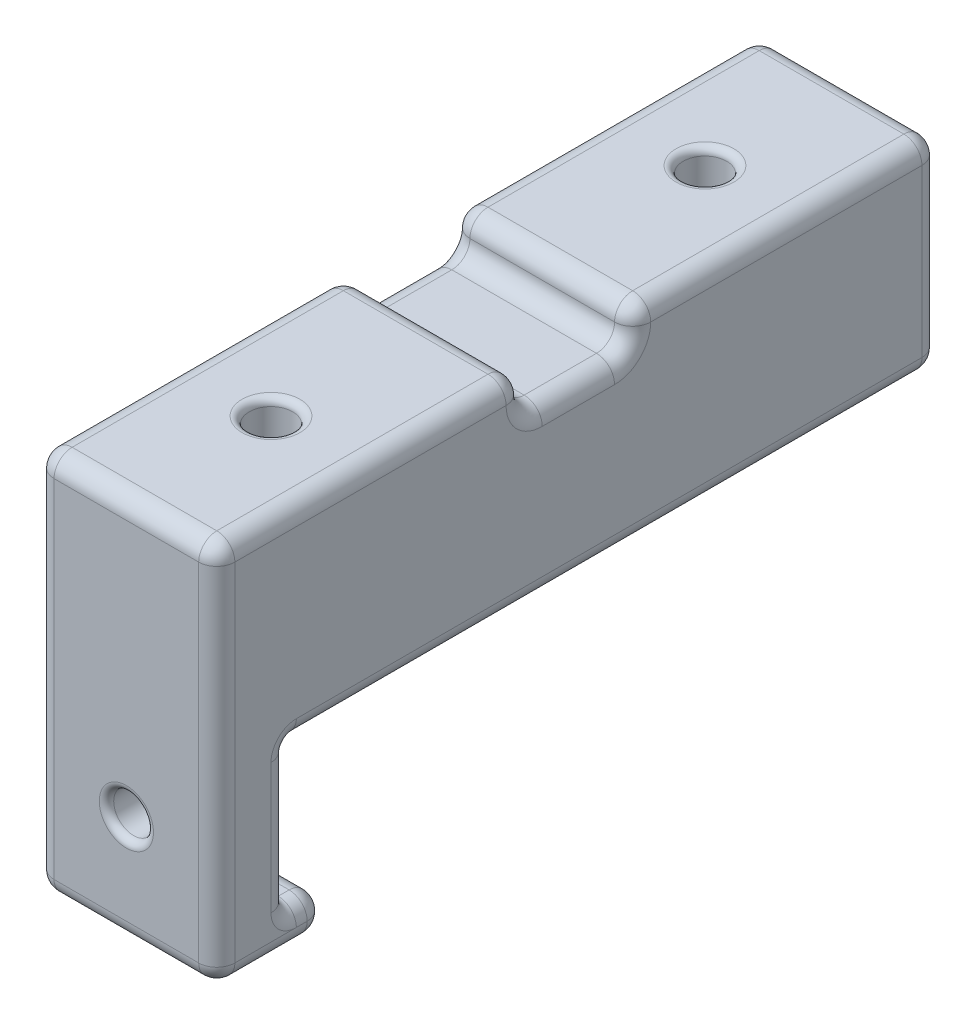
from build123d import *

# Parameters (mm, degrees)
SKETCH_1_W          = 25
SKETCH_1_H          = 100
EXTRUDE_1_DEPTH     = 28
SKETCH_2_R          = 3
CUT_EXTRUDE_1_DEPTH = 120.529983158
SKETCH_3_W          = 10
SKETCH_3_H          = 20
EXTRUDE_2_DEPTH     = 25
SKETCH_4_R          = 2.75
CUT_EXTRUDE_2_DEPTH = 120.529983158
SKETCH_5_W          = 25
SKETCH_5_H          = 5
EXTRUDE_3_DEPTH     = 15
SKETCH_6_R          = 6.5
CUT_EXTRUDE_3_DEPTH = 18
FILLET_1_R          = 1
FILLET_2_R          = 2.5
CUT_EXTRUDE_4_DEPTH = 5
FILLET_3_R          = 2.5


with BuildPart() as part:
    # 草图1 → 凸台-拉伸1 (new body)
    with BuildSketch(Plane(origin=(0, 0, 0), x_dir=(1, 0, 0), z_dir=(0, 1, 0))):
        with Locations((46.68966864, 50)):
            Rectangle(SKETCH_1_W, SKETCH_1_H)
    extrude(amount=EXTRUDE_1_DEPTH)

    # 草图2 → 切除-拉伸1 (cut, through all)
    with BuildSketch(Plane(origin=(0, 28, 0), x_dir=(1, 0, 0), z_dir=(0, 1, 0))):
        with Locations(Location((46.68966864, 80, 0), (0, 0, 270))):
            Circle(SKETCH_2_R)
        with Locations(Location((46.68966864, 20, 0), (0, 0, 270))):
            Circle(SKETCH_2_R)
    extrude(amount=-CUT_EXTRUDE_1_DEPTH, mode=Mode.SUBTRACT)

    # 草图3 → 凸台-拉伸2 (add)
    with BuildSketch(Plane(origin=(59.18966864, 0, 0), x_dir=(0, 0, -1), z_dir=(1, 0, 0))):
        with Locations((5, -10)):
            Rectangle(SKETCH_3_W, SKETCH_3_H)
    extrude(amount=-EXTRUDE_2_DEPTH)

    # 草图4 → 切除-拉伸2 (cut, through all)
    with BuildSketch(Plane.XY):
        with Locations((46.68966864, -10)):
            Circle(SKETCH_4_R)
    extrude(amount=-CUT_EXTRUDE_2_DEPTH, mode=Mode.SUBTRACT)

    # 草图5 → 凸台-拉伸3 (add)
    with BuildSketch(Plane.XY):
        with Locations((46.68966864, -22.5)):
            Rectangle(SKETCH_5_W, SKETCH_5_H)
    extrude(amount=-EXTRUDE_3_DEPTH)

    # 草图6 → 切除-拉伸3 (cut)
    with BuildSketch(Plane.XZ):
        with Locations(Location((46.68966864, -20, 0), (0, 0, 270))):
            Circle(SKETCH_6_R)
        with Locations(Location((46.68966864, -80, 0), (0, 0, 270))):
            Circle(SKETCH_6_R)
    extrude(amount=-CUT_EXTRUDE_3_DEPTH, mode=Mode.SUBTRACT)

    # 圆角1
    fillet_1_edges = [part.edges().sort_by_distance(p)[0] for p in [
        (46.68966864, 28, -83),
        (46.68966864, 28, -23),
        (46.68966864, -20, -10),
        (46.68966864, 0, -10),
        (43.93966864, -10, -10),
        (43.93966864, -10, 0),
        (46.68966864, 18, -13.5),
        (46.68966864, 18, -23),
        (46.68966864, 18, -73.5),
        (46.68966864, 18, -83),
    ]]
    fillet(fillet_1_edges, radius=FILLET_1_R)

    # 圆角2
    fillet_2_edges = [part.edges().sort_by_distance(p)[0] for p in [
        (59.18966864, 28, -50),
        (46.68966864, 28, -100),
        (34.18966864, -22.5, -15),
        (34.18966864, -25, -7.5),
        (34.18966864, -20, -13),
        (46.68966864, -20, -15),
        (34.18966864, 28, -50),
        (46.68966864, 0, -100),
        (59.18966864, -22.5, -15),
        (59.18966864, -20, -13),
        (46.68966864, -25, -15),
        (59.18966864, -25, -7.5),
        (46.68966864, -25, 0),
        (34.18966864, 0, -55.5),
        (46.68966864, 0, -13.5),
        (46.68966864, 0, -73.5),
        (34.18966864, -10, -10),
        (59.18966864, -10, -10),
        (34.18966864, 14, -100),
        (59.18966864, 14, -100),
        (59.18966864, 1.5, 0),
        (34.18966864, 1.5, 0),
        (46.68966864, 28, 0),
        (59.18966864, 0, -55.5),
        (59.18966864, -19.707106781, -10.292893219),
        (34.18966864, -19.707106781, -10.292893219),
        (59.18966864, -0.292893219, -10.292893219),
        (34.18966864, -0.292893219, -10.292893219),
    ]]
    fillet(fillet_2_edges, radius=FILLET_2_R - 0.0001)  # a hair under: the kernel refuses the full size

    # 草图7 → 切除-拉伸4 (cut)
    with BuildSketch(Plane(origin=(0, 28, 0), x_dir=(1, 0, 0), z_dir=(0, 1, 0))):
        Polygon((34.18966864, 50), (34.18966864, 57.5), (59.18966864, 57.5), (59.18966864, 42.5), (34.18966864, 42.5), align=None)
    extrude(amount=-CUT_EXTRUDE_4_DEPTH, mode=Mode.SUBTRACT)

    # 圆角3
    fillet_3_edges = [part.edges().sort_by_distance(p)[0] for p in [
        (46.68966864, 28, -57.5),
        (46.68966864, 28, -42.5),
        (58.457464883, 27.267796242, -57.5),
        (34.921872398, 27.267796242, -57.5),
        (58.457464883, 27.267796242, -42.5),
        (34.921872398, 27.267796242, -42.5),
        (46.68966864, 23, -57.5),
        (59.18966864, 23, -50),
        (46.68966864, 23, -42.5),
        (34.18966864, 23, -50),
    ]]
    fillet(fillet_3_edges, radius=FILLET_3_R - 0.0001)  # a hair under: the kernel refuses the full size


solid = part.part
